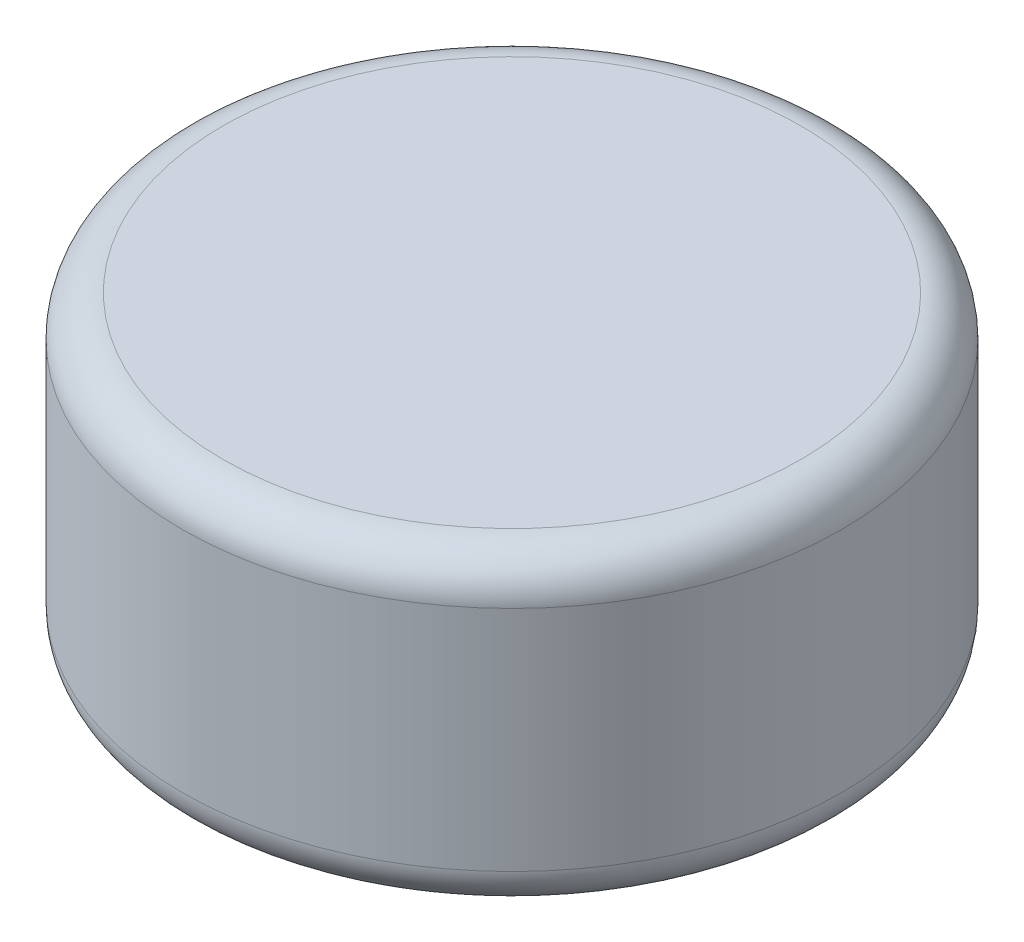
from build123d import *

# Parameters (mm, degrees)
SKETCH1_R           = 40.64
BOSS_EXTRUDE1_DEPTH = 38.100000066
FILLET1_R           = 5
SKETCH2_R           = 3.175
CUT_EXTRUDE1_DEPTH  = 25.4


with BuildPart() as part:
    # Sketch1 → Boss-Extrude1 (new body)
    with BuildSketch(Plane(origin=(0, 0, 0), x_dir=(1, 0, 0), z_dir=(0, 1, 0))):
        Circle(SKETCH1_R)
    extrude(amount=BOSS_EXTRUDE1_DEPTH)

    # Fillet1
    fillet1_edges = [part.edges().sort_by_distance(p)[0] for p in [
        (-40.64, 0, 0),
        (-40.64, 38.100000066, 0),
    ]]
    fillet(fillet1_edges, radius=FILLET1_R)

    # Sketch2 → Cut-Extrude1 (cut)
    with BuildSketch(Plane.XZ):
        with Locations((1.587001014, -0.118729115)):
            Circle(SKETCH2_R)
    extrude(amount=-CUT_EXTRUDE1_DEPTH, mode=Mode.SUBTRACT)


solid = part.part
